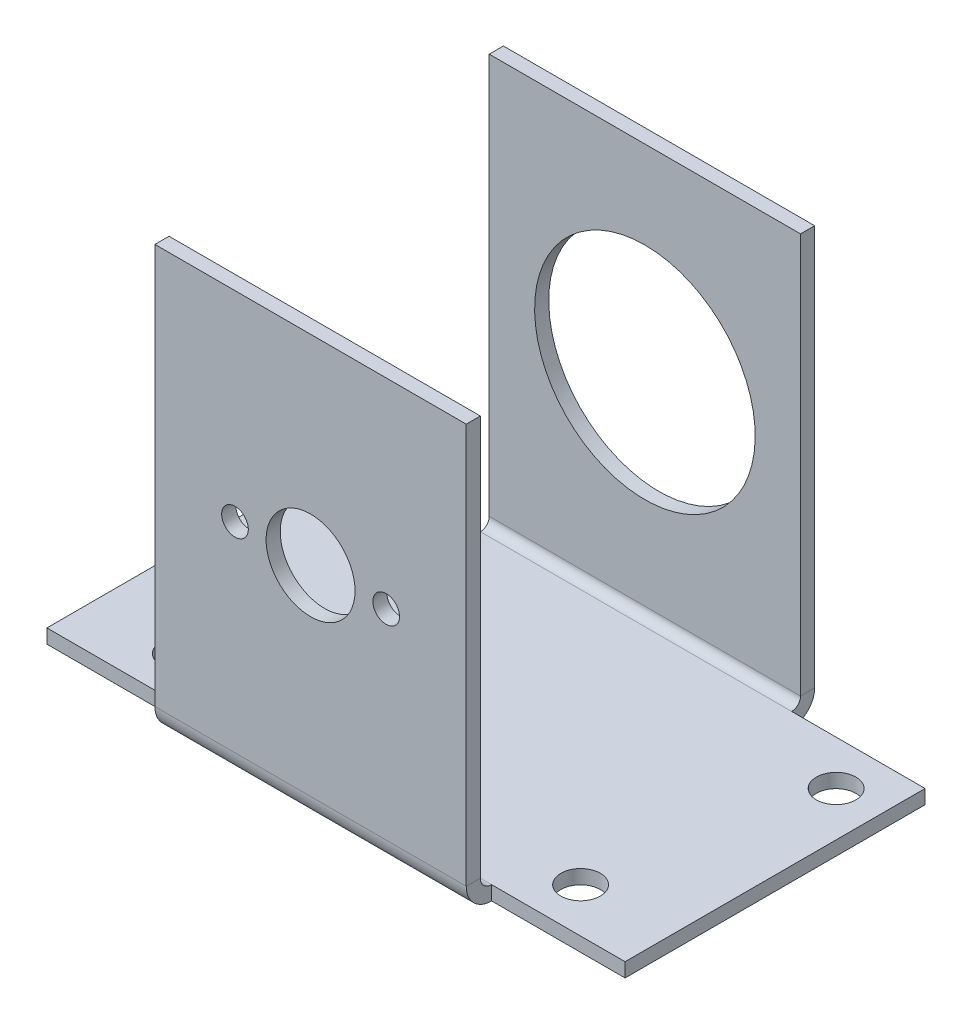
from build123d import *

# Parameters (mm, degrees)
SKETCH1_W                  = 35
SKETCH1_H                  = 45
SKETCH1_R                  = 1.5
SKETCH1_R_2                = 5
BOSS_EXTRUDE1_DEPTH        = 0.79375
CONVERT_SOLID2_START       = -0.79375
CONVERT_SOLID2_OUTLINE_W   = 35
CONVERT_SOLID2_OUTLINE_H   = 45
CONVERT_SOLID2_OUTLINE_R   = 1.5
CONVERT_SOLID2_OUTLINE_R_2 = 5
CONVERT_SOLID2_DEPTH       = 0.79375
EDGE_FLANGE1_DEPTH         = 35
EDGE_FLANGE2_DEPTH         = 35
SKETCH24_R                 = 12.4
CUT_EXTRUDE1_DEPTH         = 10
SKETCH29_W                 = 15
SKETCH29_H                 = 33.73
TAB1_DEPTH                 = 1.5875
SKETCH32_W                 = 15
SKETCH32_H                 = 33.73
TAB2_DEPTH                 = 1.5875
SKETCH35_R                 = 2.2225
CUT_EXTRUDE2_DEPTH         = 10


# Read off the part's stored shape, not the designer's step: Convert-Solid2
# Sheet-metal steps are written as plain solids
with BuildPart() as part:
    # Sketch1 → Boss-Extrude1 (new body)
    with BuildSketch(Plane.XY):
        Rectangle(SKETCH1_W, SKETCH1_H)
        with Locations((-8.5, 0)):
            Circle(SKETCH1_R, mode=Mode.SUBTRACT)
        with Locations((8.5, 0)):
            Circle(SKETCH1_R, mode=Mode.SUBTRACT)
        Circle(SKETCH1_R_2, mode=Mode.SUBTRACT)
    extrude(amount=BOSS_EXTRUDE1_DEPTH)

    # Convert-Solid2 outline → Convert-Solid2 (add)
    with BuildSketch(Plane.XY.offset(CONVERT_SOLID2_START)):
        Rectangle(CONVERT_SOLID2_OUTLINE_W, CONVERT_SOLID2_OUTLINE_H)
        with Locations((-8.5, 0)):
            Circle(CONVERT_SOLID2_OUTLINE_R, mode=Mode.SUBTRACT)
        Circle(CONVERT_SOLID2_OUTLINE_R_2, mode=Mode.SUBTRACT)
        with Locations((8.5, 0)):
            Circle(CONVERT_SOLID2_OUTLINE_R, mode=Mode.SUBTRACT)
    extrude(amount=CONVERT_SOLID2_DEPTH)

    # Edge-Flange1 section (across the edge) → Edge-Flange1 (add)
    with BuildSketch(Plane(origin=(17.5, -23.77, -0.79375), x_dir=(0, 1, 0), z_dir=(-1, 0, 0))):
        with BuildLine():
            Line((-1.5875, 1.27), (-1.5875, 35))
            Line((-1.5875, 35), (0, 35))
            Line((0, 35), (0, 1.27))
            ThreePointArc((0, 1.27), (0.371974388, 0.371974388), (1.27, 0))
            Line((1.27, 0), (1.27, -1.5875))
            ThreePointArc((1.27, -1.5875), (-0.750557627, -0.750557627), (-1.5875, 1.27))
        make_face()
    extrude(amount=EDGE_FLANGE1_DEPTH)

    # Edge-Flange2 section (across the edge) → Edge-Flange2 (add)
    with BuildSketch(Plane(origin=(17.5, -23.77, -36.79375), x_dir=(0, 0, 1), z_dir=(-1, 0, 0))):
        with BuildLine():
            Line((-1.5875, 1), (-1.5875, 46))
            Line((-1.5875, 46), (0, 46))
            Line((0, 46), (0, 1))
            ThreePointArc((0, 1), (0.292893219, 0.292893219), (1, 0))
            Line((1, 0), (1, -1.5875))
            ThreePointArc((1, -1.5875), (-0.829638796, -0.829638796), (-1.5875, 1))
        make_face()
    extrude(amount=EDGE_FLANGE2_DEPTH)

    # Sketch24 → Cut-Extrude1 (cut)
    with BuildSketch(Plane(origin=(0, 0, -38.38125), x_dir=(-1, 0, 0), z_dir=(0, 0, -1))):
        with Locations(Location((0, 0, 0), (0, 0, 90))):
            Circle(SKETCH24_R)
    extrude(amount=-CUT_EXTRUDE1_DEPTH, mode=Mode.SUBTRACT)

    # Sketch29 → Tab1 (add)
    with BuildSketch(Plane(origin=(0, -23.77, 0), x_dir=(1, 0, 0), z_dir=(0, 1, 0))):
        with Locations((25, 18.92875)):
            Rectangle(SKETCH29_W, SKETCH29_H)
    extrude(amount=-TAB1_DEPTH)

    # Sketch32 → Tab2 (add)
    with BuildSketch(Plane(origin=(0, -23.77, 0), x_dir=(1, 0, 0), z_dir=(0, 1, 0))):
        with Locations((-25, 18.92875)):
            Rectangle(SKETCH32_W, SKETCH32_H)
    extrude(amount=-TAB2_DEPTH)

    # Sketch35 → Cut-Extrude2 (cut)
    with BuildSketch(Plane(origin=(0, -23.77, 0), x_dir=(1, 0, 0), z_dir=(0, 1, 0))):
        with Locations(Location((22.5, 7.06375, 0), (0, 0, 270))):
            Circle(SKETCH35_R)
        with Locations(Location((27.5, 30.79375, 0), (0, 0, 270))):
            Circle(SKETCH35_R)
    cut_extrude2 = extrude(amount=-CUT_EXTRUDE2_DEPTH, mode=Mode.SUBTRACT)

    # Mirror1: Cut-Extrude2 across plane
    add(cut_extrude2.mirror(Plane(origin=(0, 0, 0), x_dir=(0, 0, 1), z_dir=(1, 0, 0))), mode=Mode.SUBTRACT)


solid = part.part
